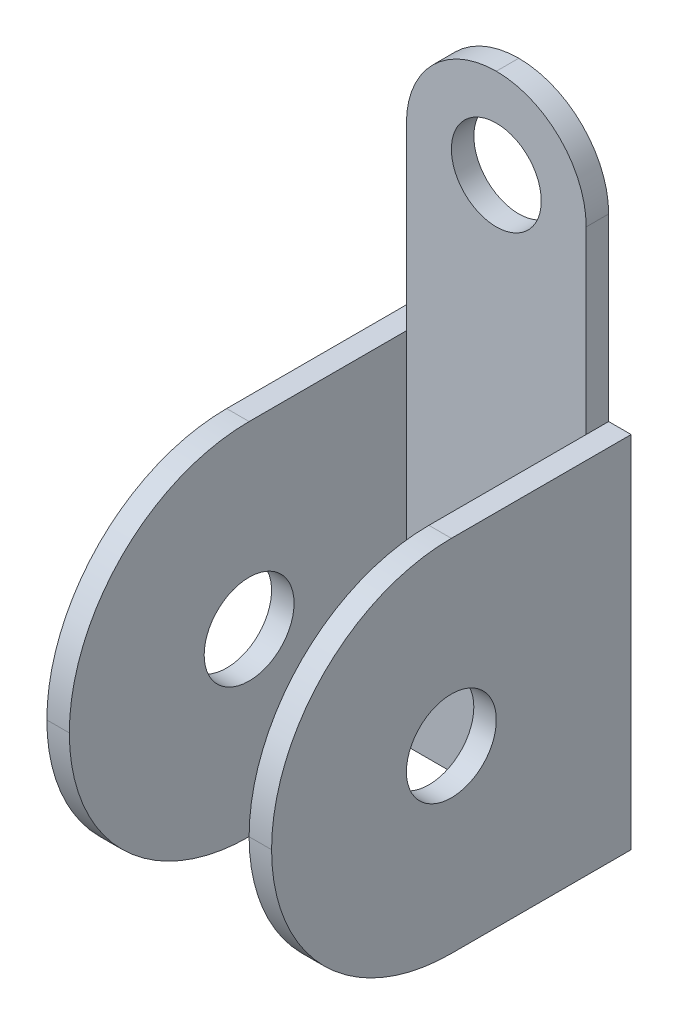
from build123d import *

# Parameters (mm, degrees)
SKETCH1_W           = 12.7
SKETCH1_H           = 25.4
SKETCH1_H_2         = 19.05
SKETCH1_R           = 3.175
BOSS_EXTRUDE1_DEPTH = 1.5875
SKETCH1_3_W         = 1.5875
SKETCH1_3_H         = 25.4
BOSS_EXTRUDE2_DEPTH = 25.4
SKETCH2_R           = 3.175
CUT_EXTRUDE1_DEPTH  = 44.649033494
FILLET1_R           = 12.7
FILLET2_R           = 6.35


with BuildPart() as part:
    # Sketch1 → Boss-Extrude1 (new body)
    # profile 1 of 2: a face of its own
    with BuildSketch(Plane.XY):
        Rectangle(SKETCH1_W, SKETCH1_H)
    # profile 2 of 2: a face of its own
    with BuildSketch(Plane.XY):
        with Locations((0, 22.225)):
            Rectangle(SKETCH1_W, SKETCH1_H_2)
        with Locations((0, 25.4)):
            Circle(SKETCH1_R, mode=Mode.SUBTRACT)
    extrude(amount=BOSS_EXTRUDE1_DEPTH)

    # Sketch1<3> → Boss-Extrude2 (add)
    with BuildSketch(Plane.XY):
        with Locations((-7.14375, 0)):
            Rectangle(SKETCH1_3_W, SKETCH1_3_H)
        with Locations((7.14375, 0)):
            Rectangle(SKETCH1_3_W, SKETCH1_3_H)
    extrude(amount=BOSS_EXTRUDE2_DEPTH)

    # Sketch2 → Cut-Extrude1 (cut, through all)
    with BuildSketch(Plane.ZY.offset(7.9375)):
        with Locations((12.7, 0)):
            Circle(SKETCH2_R)
    extrude(amount=-CUT_EXTRUDE1_DEPTH, mode=Mode.SUBTRACT)

    # Fillet1
    fillet1_edges = [part.edges().sort_by_distance(p)[0] for p in [
        (-7.14375, -12.7, 25.4),
        (7.14375, -12.7, 25.4),
        (7.14375, 12.7, 25.4),
        (-7.14375, 12.7, 25.4),
    ]]
    fillet(fillet1_edges, radius=FILLET1_R - 0.0001)  # a hair under: the kernel refuses the full size

    # Fillet2
    fillet2_edges = [part.edges().sort_by_distance(p)[0] for p in [
        (-6.35, 31.75, 0.79375),
        (6.35, 31.75, 0.79375),
    ]]
    fillet(fillet2_edges, radius=FILLET2_R - 0.0001)  # a hair under: the kernel refuses the full size


solid = part.part
